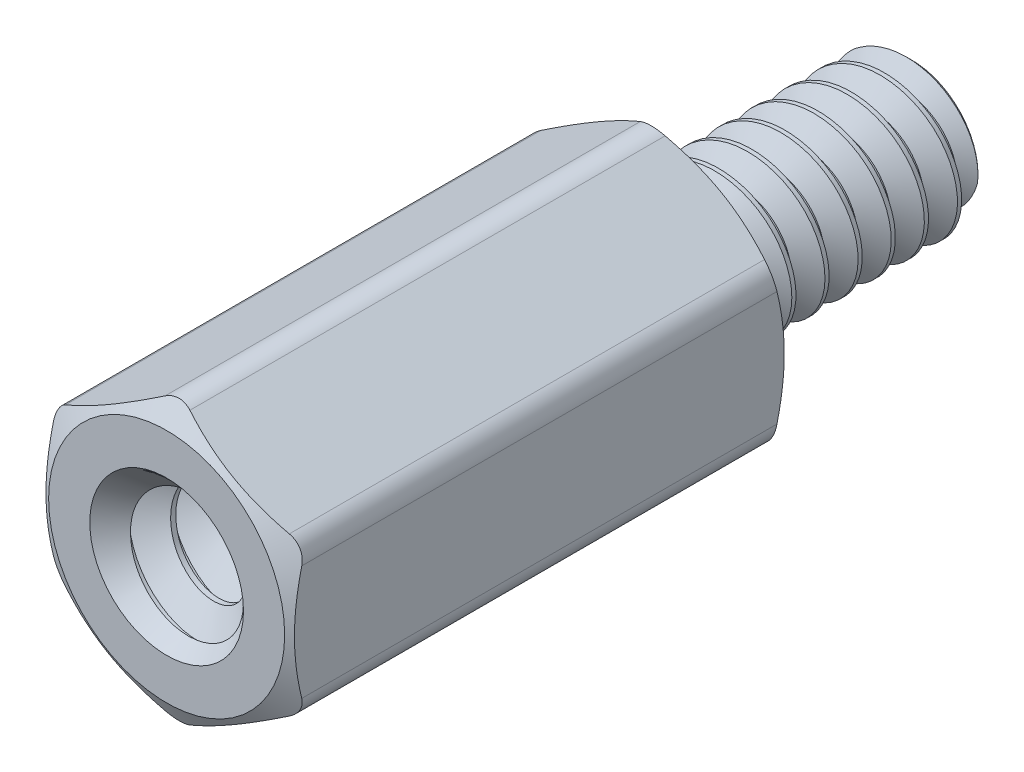
from build123d import *

# Parameters (mm, degrees)
SKETCH4_R           = 1.901825
BOSS_EXTRUDE1_DEPTH = 9.525
SKETCH5_OUTSIDE_W   = 64.504
SKETCH5_OUTSIDE_H   = 65.242
SKETCH5_OUTSIDE_R   = 2.2621875
CUT_EXTRUDE1_DEPTH  = 15.743251899
CUT_EXTRUDE1_DRAFT  = -60
SKETCH6_OUTSIDE_W   = 48.752
SKETCH6_OUTSIDE_H   = 49.49
SKETCH6_OUTSIDE_R   = 2.2621875
CUT_EXTRUDE2_DEPTH  = 11.195903359
CUT_EXTRUDE2_DRAFT  = -60
FILLET1_R           = 0.47625
CUT_SWEEP1_PITCH    = 0.635
SKETCH9_R           = 1.58115
BOSS_EXTRUDE2_DEPTH = 6.35
SKETCH10_W          = 6.35
SKETCH10_H          = 1.4224
CUT_SWEEP2_PITCH    = 0.79375


with BuildPart() as part:
    # Sketch3 → Revolve1 (revolve)
    with BuildSketch(Plane(origin=(0, 0, 0), x_dir=(0, 0, -1), z_dir=(1, 0, 0))):
        with BuildLine():
            Line((-3.175, 1.26365), (-3.175, 0))
            Line((-3.175, 0), (4.7625, 0))
            Line((4.7625, 0), (4.7625, 1.26365))
            Line((4.7625, 1.26365), (4.60375, 1.4224))
            Line((4.60375, 1.4224), (0.809625, 1.4224))
            Line((0.809625, 1.4224), (0.5715, 1.009955401))
            Line((0.5715, 1.009955401), (0.15875, 1.009955401))
            ThreePointArc((0.15875, 1.009955401), (0.046496798, 1.0564522), (0, 1.168705401))
            Line((0, 1.168705401), (0, 2.38125))
            Line((0, 2.38125), (-9.525, 2.38125))
            Line((-9.525, 2.38125), (-9.525, 1.58115))
            Line((-9.525, 1.58115), (-9.36625, 1.4224))
            Line((-9.36625, 1.4224), (-3.33375, 1.4224))
            Line((-3.33375, 1.4224), (-3.175, 1.26365))
        make_face()
    revolve(axis=Axis((0, 0, -4.7625), (0, 0, 1)))

    # Sketch4 → Boss-Extrude1 (add)
    with BuildSketch(Plane.XY.offset(9.525)):
        Polygon((-2.38125, 1.374815329), (-2.38125, -1.374815329), (0, -2.749630657), (2.38125, -1.374815329), (2.38125, 1.374815329), (0, 2.749630657), align=None)
        Circle(SKETCH4_R, mode=Mode.SUBTRACT)
    extrude(amount=-BOSS_EXTRUDE1_DEPTH)


with BuildPart() as cut_extrude1_tool:
    # Sketch5 outside → Cut-Extrude1 (with draft: the straight prism first)
    with BuildSketch(Plane.XY.offset(9.525)):
        Rectangle(SKETCH5_OUTSIDE_W, SKETCH5_OUTSIDE_H)
        Circle(SKETCH5_OUTSIDE_R, mode=Mode.SUBTRACT)
    extrude(amount=-CUT_EXTRUDE1_DEPTH)
    # Cut-Extrude1: the draft: its side faces are tilted about the plane it starts from
    cut_extrude1_sides = [cut_extrude1_tool.faces().sort_by_distance(p)[0] for p in [
        (0, -32.621, 1.65337405),
        (32.252, 0, 1.65337405),
        (0, 32.621, 1.65337405),
        (-32.252, 0, 1.65337405),
        (-2.2621875, 0, 1.65337405),
    ]]
    draft(cut_extrude1_sides, Plane.XY.offset(9.525), CUT_EXTRUDE1_DRAFT)


with BuildPart() as part_1:
    add(part.part)

    # Cut-Extrude1: cut by cut_extrude1_tool
    add(cut_extrude1_tool.part, mode=Mode.SUBTRACT)


with BuildPart() as cut_extrude2_tool:
    # Sketch6 outside → Cut-Extrude2 (with draft: the straight prism first)
    with BuildSketch(Plane(origin=(0, 0, 0), x_dir=(-1, 0, 0), z_dir=(0, 0, -1))):
        Rectangle(SKETCH6_OUTSIDE_W, SKETCH6_OUTSIDE_H)
        Circle(SKETCH6_OUTSIDE_R, mode=Mode.SUBTRACT)
    extrude(amount=-CUT_EXTRUDE2_DEPTH)
    # Cut-Extrude2: the draft: its side faces are tilted about the plane it starts from
    cut_extrude2_sides = [cut_extrude2_tool.faces().sort_by_distance(p)[0] for p in [
        (0, -24.745, 5.59795168),
        (-24.376, 0, 5.59795168),
        (0, 24.745, 5.59795168),
        (24.376, 0, 5.59795168),
        (2.2621875, 0, 5.59795168),
    ]]
    draft(cut_extrude2_sides, Plane(origin=(0, 0, 0), x_dir=(-1, 0, 0), z_dir=(0, 0, -1)), CUT_EXTRUDE2_DRAFT)


with BuildPart() as part_2:
    add(part_1.part)

    # Cut-Extrude2: cut by cut_extrude2_tool
    add(cut_extrude2_tool.part, mode=Mode.SUBTRACT)

    # Fillet1
    fillet1_edges = [part_2.edges().sort_by_distance(p)[0] for p in [
        (0, 2.749630657, 4.7625),
        (-2.38125, -1.374815329, 4.7625),
        (0, -2.749630657, 4.7625),
        (2.38125, -1.374815329, 4.7625),
        (2.38125, 1.374815329, 4.7625),
        (-2.38125, 1.374815329, 4.7625),
    ]]
    fillet(fillet1_edges, radius=FILLET1_R)

    # Cut-Sweep1: the profile of Sketch7 profile screwed along a right-hand helix of 7.275 turns, 6 arcs to a turn; built about Z, then put on its axis
    cut_sweep1_z = Axis((0, 0, 0), (0, 0, 1))
    cut_sweep1_corners = [(1.009655401, 0, -0.238298205), (1.009655401, 0, -0.317326795), (1.456770383, 0, -0.57546875), (1.456770383, 0, 0.01984375)]
    with BuildLine(mode=Mode.PRIVATE) as cut_sweep1_profile:
        Line(cut_sweep1_corners[0], cut_sweep1_corners[1])
        Line(cut_sweep1_corners[1], cut_sweep1_corners[2])
        Line(cut_sweep1_corners[2], cut_sweep1_corners[3])
        Line(cut_sweep1_corners[3], cut_sweep1_corners[0])
    cut_sweep1_cap = Face(cut_sweep1_profile.wire())
    cut_sweep1_turn_angles = [0, 30, 60, 90, 120, 150, 180, 210, 240, 270, 300, 330, 360]
    cut_sweep1_turn_weights = [1, 0.8660254037844387, 1, 0.8660254037844387, 1, 0.8660254037844387, 1, 0.8660254037844387, 1, 0.8660254037844387, 1, 0.8660254037844387, 1]
    cut_sweep1_turn_rails = [Edge.make_bspline([Vector(p[0], p[1], 0).rotate(cut_sweep1_z, cut_sweep1_turn_angles[k]) / cut_sweep1_turn_weights[k] + Vector(0, 0, p[2] + CUT_SWEEP1_PITCH * cut_sweep1_turn_angles[k] / 360) for k in range(13)], [0, 0, 0, 1, 1, 2, 2, 3, 3, 4, 4, 5, 5, 6, 6, 6], 2, cut_sweep1_turn_weights) for p in cut_sweep1_corners]
    cut_sweep1_turn_sides = [Face.make_surface_from_curves(cut_sweep1_turn_rails[p[0]], cut_sweep1_turn_rails[p[1]]) for p in [(0, 1), (1, 2), (2, 3), (3, 0)]]
    cut_sweep1_last_angles = [2520, 2550, 2580, 2599.5, 2619]
    cut_sweep1_last_weights = [1, 0.8660254037844387, 1, 0.9426414910921744, 1]
    cut_sweep1_last_rails = [Edge.make_bspline([Vector(p[0], p[1], 0).rotate(cut_sweep1_z, cut_sweep1_last_angles[k]) / cut_sweep1_last_weights[k] + Vector(0, 0, p[2] + CUT_SWEEP1_PITCH * cut_sweep1_last_angles[k] / 360) for k in range(5)], [0, 0, 0, 1, 1, 2, 2, 2], 2, cut_sweep1_last_weights) for p in cut_sweep1_corners]
    cut_sweep1_last_sides = [Face.make_surface_from_curves(cut_sweep1_last_rails[p[0]], cut_sweep1_last_rails[p[1]]) for p in [(0, 1), (1, 2), (2, 3), (3, 0)]]
    cut_sweep1 = Plane(origin=(0, 0, -4.7625), x_dir=(0, 1, 0), z_dir=(0, 0, 1)) * Solid(Shell([*[p.moved(Location((0, 0, CUT_SWEEP1_PITCH * i))) for i in range(7) for p in cut_sweep1_turn_sides], *cut_sweep1_last_sides, cut_sweep1_cap, cut_sweep1_cap.rotate(cut_sweep1_z, 2619).moved(Location((0, 0, CUT_SWEEP1_PITCH * 2619 / 360)))]))
    add(cut_sweep1, mode=Mode.SUBTRACT)

    # Sketch9 → Boss-Extrude2 (add)
    with BuildSketch(Plane.XY.offset(3.175)):
        Circle(SKETCH9_R)
    extrude(amount=BOSS_EXTRUDE2_DEPTH)


with BuildPart() as body_2:
    # Sketch10 → Revolve2 (revolve)
    with BuildSketch(Plane(origin=(0, 0, 0), x_dir=(0, 0, -1), z_dir=(1, 0, 0))):
        with Locations((-6.35, 0.7112)):
            Rectangle(SKETCH10_W, SKETCH10_H)
    revolve(axis=Axis((0, 0, -4.7625), (0, 0, 1)))

    # Cut-Sweep2: the profile of Sketch12 screwed along a right-hand helix of 9 turns, 8 arcs to a turn; built about Z, then put on its axis
    cut_sweep2_z = Axis((0, 0, 0), (0, 0, 1))
    cut_sweep2_corners = [(0.906844252, 0, -0.396875), (0.906844252, 0, -0.29765625), (1.465362979, 0, 0.024804687), (1.465362979, 0, -0.719335937)]
    with BuildLine(mode=Mode.PRIVATE) as cut_sweep2_profile:
        Line(cut_sweep2_corners[0], cut_sweep2_corners[1])
        Line(cut_sweep2_corners[1], cut_sweep2_corners[2])
        Line(cut_sweep2_corners[2], cut_sweep2_corners[3])
        Line(cut_sweep2_corners[3], cut_sweep2_corners[0])
    cut_sweep2_cap = Face(cut_sweep2_profile.wire())
    cut_sweep2_turn_angles = [0, 22.5, 45, 67.5, 90, 112.5, 135, 157.5, 180, 202.5, 225, 247.5, 270, 292.5, 315, 337.5, 360]
    cut_sweep2_turn_weights = [1, 0.9238795325112867, 1, 0.9238795325112867, 1, 0.9238795325112867, 1, 0.9238795325112867, 1, 0.9238795325112867, 1, 0.9238795325112867, 1, 0.9238795325112867, 1, 0.9238795325112867, 1]
    cut_sweep2_turn_rails = [Edge.make_bspline([Vector(p[0], p[1], 0).rotate(cut_sweep2_z, cut_sweep2_turn_angles[k]) / cut_sweep2_turn_weights[k] + Vector(0, 0, p[2] + CUT_SWEEP2_PITCH * cut_sweep2_turn_angles[k] / 360) for k in range(17)], [0, 0, 0, 1, 1, 2, 2, 3, 3, 4, 4, 5, 5, 6, 6, 7, 7, 8, 8, 8], 2, cut_sweep2_turn_weights) for p in cut_sweep2_corners]
    cut_sweep2_turn_sides = [Face.make_surface_from_curves(cut_sweep2_turn_rails[p[0]], cut_sweep2_turn_rails[p[1]]) for p in [(0, 1), (1, 2), (2, 3), (3, 0)]]
    cut_sweep2 = Plane(origin=(0, 0, 9.525), x_dir=(0, 1, 0), z_dir=(0, 0, -1)) * Solid(Shell([*[p.moved(Location((0, 0, CUT_SWEEP2_PITCH * i))) for i in range(9) for p in cut_sweep2_turn_sides], cut_sweep2_cap, cut_sweep2_cap.rotate(cut_sweep2_z, 3240).moved(Location((0, 0, CUT_SWEEP2_PITCH * 3240 / 360)))]))
    add(cut_sweep2, mode=Mode.SUBTRACT)


with BuildPart() as part_3:
    add(part_2.part)

    # Combine1: cut body 2
    add(body_2.part, mode=Mode.SUBTRACT)

    # Cut-Extrude3 cone 1 section (through the dimple's axis) → Cut-Extrude3 (revolve, cut)
    with BuildSketch(Plane(origin=(0, 0, 9.525), x_dir=(0, -1, 0), z_dir=(1, 0, 0))):
        Polygon((0, 0), (1.4732, 0), (0, 1.4732), align=None)
    revolve(axis=Axis((0, 0, 9.525), (0, 0, -1)), mode=Mode.SUBTRACT)


solid = part_3.part
